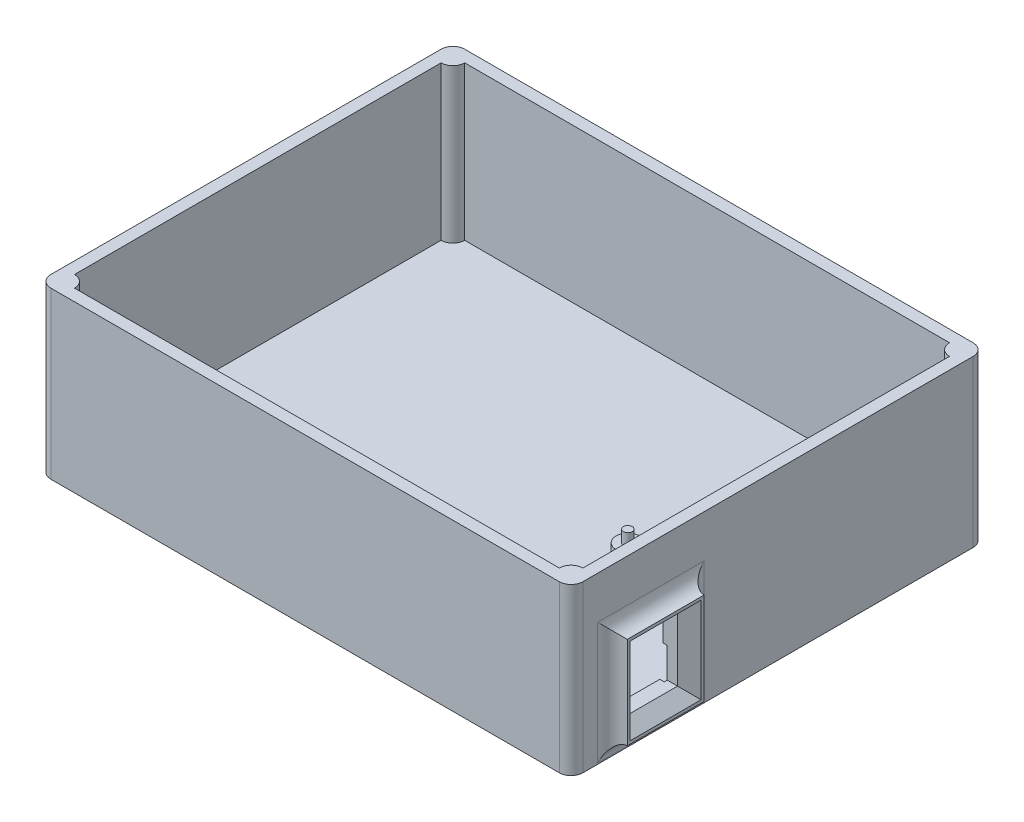
from build123d import *

# Parameters (mm, degrees)
SKETCH1_W           = 114.3
SKETCH1_H           = 88.9
BOSS_EXTRUDE1_DEPTH = 35.56
SHELL1_T            = -2.54
FILLET1_R           = 2.54
SKETCH2_R           = 2.54
BOSS_EXTRUDE2_DEPTH = 33.02
SKETCH4_W           = 13.97
SKETCH4_H           = 10.541
CUT_EXTRUDE2_DEPTH  = 0.9525
SKETCH5_R           = 2.54
BOSS_EXTRUDE3_DEPTH = 3.175
SKETCH6_R           = 0.9525
BOSS_EXTRUDE4_DEPTH = 2.54
CUT_EXTRUDE3_REACH  = 129.69
SKETCH7_W           = 10.16
SKETCH7_H           = 13.462
SKETCH8_W           = 16.51
SKETCH8_H           = 19.812
SKETCH8_W_2         = 10.16
SKETCH8_H_2         = 13.462
BOSS_EXTRUDE5_DEPTH = 3.175
CHAMFER1_SIZE       = 2.54
FILLET2_R           = 3.175


with BuildPart() as part:
    # Sketch1 → Boss-Extrude1 (new body)
    with BuildSketch(Plane(origin=(0, 0, 0), x_dir=(1, 0, 0), z_dir=(0, 1, 0))):
        Rectangle(SKETCH1_W, SKETCH1_H)
    extrude(amount=BOSS_EXTRUDE1_DEPTH)

    # Shell1
    shell1_openings = [part.faces().sort_by_distance(p)[0] for p in [
        (0, 35.56, 0),
    ]]
    offset(amount=SHELL1_T, openings=shell1_openings, kind=Kind.INTERSECTION)

    # Fillet1
    fillet1_edges = [part.edges().sort_by_distance(p)[0] for p in [
        (-54.61, 19.05, -41.91),
        (-54.61, 19.05, 41.91),
        (54.61, 19.05, 41.91),
        (54.61, 19.05, -41.91),
        (-57.15, 17.78, -44.45),
        (57.15, 17.78, -44.45),
        (57.15, 17.78, 44.45),
        (-57.15, 17.78, 44.45),
    ]]
    fillet(fillet1_edges, radius=FILLET1_R)

    # Sketch2 → Boss-Extrude2 (add)
    with BuildSketch(Plane(origin=(0, 35.56, 0), x_dir=(1, 0, 0), z_dir=(0, 1, 0))):
        with Locations((-54.61, 41.91)):
            Circle(SKETCH2_R)
        with Locations((54.61, 41.91)):
            Circle(SKETCH2_R)
        with Locations((54.61, -41.91)):
            Circle(SKETCH2_R)
        with Locations((-54.61, -41.91)):
            Circle(SKETCH2_R)
    extrude(amount=-BOSS_EXTRUDE2_DEPTH)

    # Sketch4 → Cut-Extrude2 (cut)
    with BuildSketch(Plane.ZY.offset(-54.61)):
        with Locations((15.875, 7.8105)):
            Rectangle(SKETCH4_W, SKETCH4_H)
    extrude(amount=-CUT_EXTRUDE2_DEPTH, mode=Mode.SUBTRACT)

    # Sketch5 → Boss-Extrude3 (add)
    with BuildSketch(Plane(origin=(0, 2.54, 0), x_dir=(1, 0, 0), z_dir=(0, 1, 0))):
        with Locations(Location((24.892, 0, 0), (0, 0, 90))):
            Circle(SKETCH5_R)
        with Locations(Location((50.292, 0, 0), (0, 0, 90))):
            Circle(SKETCH5_R)
        with Locations(Location((24.892, -35.56, 0), (0, 0, 90))):
            Circle(SKETCH5_R)
        with Locations(Location((50.292, -35.56, 0), (0, 0, 90))):
            Circle(SKETCH5_R)
    extrude(amount=BOSS_EXTRUDE3_DEPTH)

    # Sketch6 → Boss-Extrude4 (add)
    with BuildSketch(Plane(origin=(0, 5.715, 0), x_dir=(1, 0, 0), z_dir=(0, 1, 0))):
        with Locations(Location((24.892, 0, 0), (0, 0, 270))):
            Circle(SKETCH6_R)
        with Locations(Location((50.292, 0, 0), (0, 0, 270))):
            Circle(SKETCH6_R)
        with Locations(Location((50.292, -35.56, 0), (0, 0, 270))):
            Circle(SKETCH6_R)
        with Locations(Location((24.892, -35.56, 0), (0, 0, 270))):
            Circle(SKETCH6_R)
    extrude(amount=BOSS_EXTRUDE4_DEPTH)

    # Sketch7 → Cut-Extrude3 (cut, up to next)
    with BuildSketch(Plane(origin=(57.15, 0, 0), x_dir=(0, 0, -1), z_dir=(1, 0, 0)), mode=Mode.PRIVATE) as cut_extrude3_sk1:
        with Locations((-27.305, 13.335)):
            Rectangle(SKETCH7_W, SKETCH7_H)
    cut_extrude3_tool1 = extrude(cut_extrude3_sk1.sketch, amount=-CUT_EXTRUDE3_REACH, mode=Mode.PRIVATE) & part.part
    add(cut_extrude3_tool1.solids().sort_by_distance((57.15, 13.335, 27.305))[0], mode=Mode.SUBTRACT)

    # Sketch8 → Boss-Extrude5 (add)
    with BuildSketch(Plane(origin=(57.15, 0, 0), x_dir=(0, 0, -1), z_dir=(1, 0, 0))):
        with Locations((-27.305, 13.335)):
            Rectangle(SKETCH8_W, SKETCH8_H)
        with Locations((-27.305, 13.335)):
            Rectangle(SKETCH8_W_2, SKETCH8_H_2, mode=Mode.SUBTRACT)
    extrude(amount=BOSS_EXTRUDE5_DEPTH)

    # Chamfer1
    chamfer1_edges = [part.edges().sort_by_distance(p)[0] for p in [
        (60.325, 13.335, 32.385),
        (60.325, 6.604, 27.305),
        (60.325, 13.335, 22.225),
        (60.325, 20.066, 27.305),
    ]]
    chamfer(chamfer1_edges, length=CHAMFER1_SIZE)

    # Fillet2
    fillet2_edges = [part.edges().sort_by_distance(p)[0] for p in [
        (57.15, 3.429, 27.305),
        (57.15, 13.335, 19.05),
        (57.15, 23.241, 27.305),
        (57.15, 13.335, 35.56),
    ]]
    fillet(fillet2_edges, radius=FILLET2_R - 0.0001)  # a hair under: the kernel refuses the full size


solid = part.part
